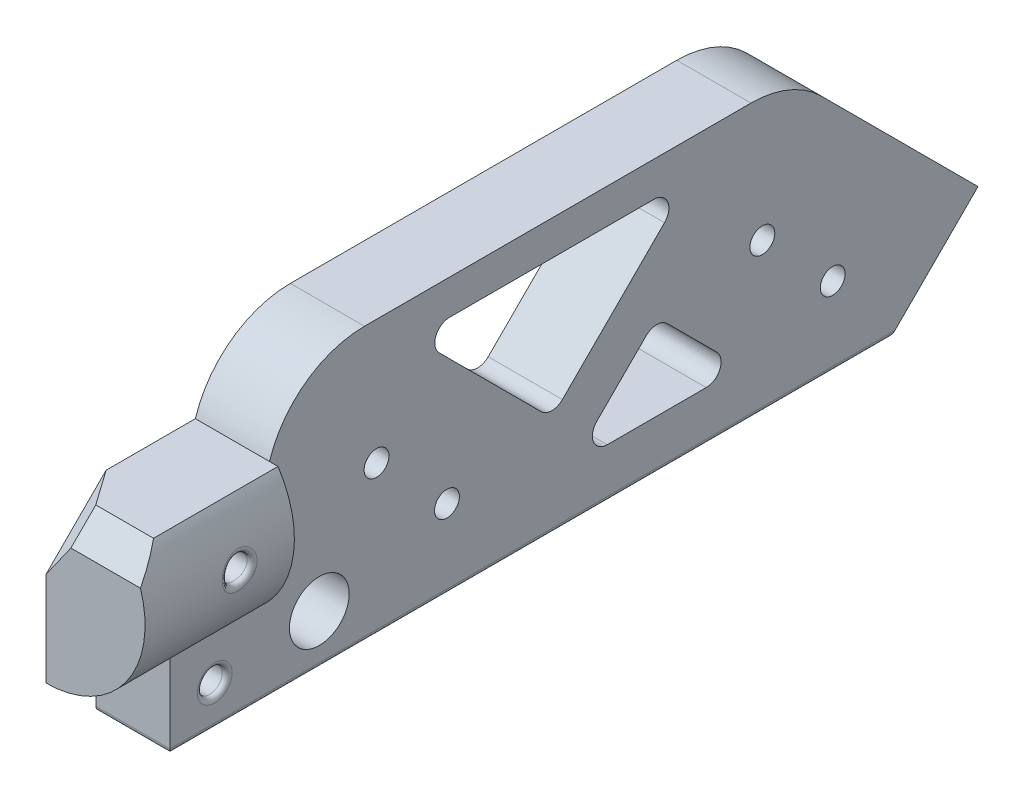
from build123d import *
from build123d.topology import SkipClean

# Parameters (mm, degrees)
EXTRUDE_1_DEPTH            = 21
SKETCH_2_W                 = 20
SKETCH_2_H                 = 20
CUT_EXTRUDE_1_DEPTH        = 10
SKETCH_3_R                 = 25
EXTRUDE_2_DEPTH            = 2
SKETCH_4_W                 = 20
SKETCH_4_H                 = 20
CUT_EXTRUDE_2_DEPTH        = 20
SKETCH_5_W                 = 67.669648092
SKETCH_5_H                 = 52.455829112
CUT_EXTRUDE_3_DEPTH        = 22
EXTRUDE_5_DEPTH            = 1
CUT_EXTRUDE_START          = -6
CUT_EXTRUDE_12_DEPTH       = 6
CUT_EXTRUDE_13_DEPTH       = 2
SKETCH_21_W                = 20
SKETCH_21_H                = 20
EXTRUDE_7_DEPTH            = 19
SKETCH_22_W                = 30
SKETCH_22_H                = 20
EXTRUDE_8_DEPTH            = 10
EXTRUDE_START              = 10
EXTRUDE_9_DEPTH            = 10
SKETCH_24_W                = 30
SKETCH_24_H                = 50
EXTRUDE_10_DEPTH           = 160
SKETCH_26_R                = 2.5
CUT_EXTRUDE_15_DEPTH       = 50
CUT_EXTRUDE_1_2_DEPTH      = 10
CUT_EXTRUDE_1_2_DEPTH_BACK = 10
SKETCH_28_W                = 30
SKETCH_28_H                = 160
EXTRUDE_11_DEPTH           = 5
CUT_EXTRUDE_16_DEPTH       = 25
CUT_EXTRUDE_16_DEPTH_BACK  = 60
SKETCH_29_R                = 2.5
CUT_EXTRUDE_17_DEPTH       = 60
CUT_EXTRUDE_18_DEPTH       = 60
CUT_EXTRUDE_18_DEPTH_BACK  = 60
CUT_EXTRUDE_19_DEPTH       = 60
CUT_EXTRUDE_19_DEPTH_BACK  = 60
FILLET_4_R                 = 3
CUT_EXTRUDE_20_DEPTH       = 60
CUT_EXTRUDE_20_DEPTH_BACK  = 60
SKETCH_33_R                = 6
CUT_EXTRUDE_21_DEPTH       = 60
FILLET_5_R                 = 20
SKETCH_35_R                = 2.5
CUT_EXTRUDE_22_DEPTH       = 60
FILLET_6_R                 = 20
SKETCH_36_W                = 257.466692503
SKETCH_36_H                = 187.225779306
CUT_EXTRUDE_23_DEPTH       = 82
CUT_EXTRUDE_24_DEPTH       = 0.1
FILLET_7_R                 = 1
FILLET_8_R                 = 1
CHAMFER_1_SIZE             = 5
CHAMFER_2_SIZE             = 5


with BuildPart() as part:
    # 草图1 → 凸台-拉伸1 (new body)
    with BuildSketch(Plane.XY):
        with BuildLine():
            Line((16.703293088, 11), (-16.703293088, 11))
            ThreePointArc((-16.703293088, 11), (0, -20), (16.703293088, 11))
        make_face()
    extrude(amount=EXTRUDE_1_DEPTH)

    # 草图2 → Cut-Extrude 1 (cut)
    with BuildSketch(Plane.XY.offset(21)):
        Rectangle(SKETCH_2_W, SKETCH_2_H)
    extrude(amount=-CUT_EXTRUDE_1_DEPTH, mode=Mode.SUBTRACT)

    # 草图3 → 凸台-拉伸2 (add)
    with BuildSketch(Plane(origin=(0, 0, 0), x_dir=(-1, 0, 0), z_dir=(0, 0, -1))):
        Circle(SKETCH_3_R)
        with BuildLine():
            Line((16.703293088, 11), (-16.703293088, 11))
            ThreePointArc((-16.703293088, 11), (0, -20), (16.703293088, 11))
        make_face(mode=Mode.SUBTRACT)
    extrude(amount=-EXTRUDE_2_DEPTH)

    # 草图4 → 切除-拉伸2 (cut)
    with BuildSketch(Plane.XY.offset(11)):
        Rectangle(SKETCH_4_W, SKETCH_4_H)
    extrude(amount=-CUT_EXTRUDE_2_DEPTH, mode=Mode.SUBTRACT)

    # 草图5 → 切除-拉伸3 (cut)
    with BuildSketch(Plane(origin=(0, 11, 0), x_dir=(1, 0, 0), z_dir=(0, 1, 0))):
        Rectangle(SKETCH_5_W, SKETCH_5_H)
    extrude(amount=CUT_EXTRUDE_3_DEPTH, mode=Mode.SUBTRACT)

    # 草图10 → 凸台-拉伸5 (add)
    with BuildSketch(Plane.XY.offset(21)):
        with BuildLine():
            Line((16.703293088, 11), (-16.703293088, 11))
            ThreePointArc((-16.703293088, 11), (0, -20), (16.703293088, 11))
        make_face()
    extrude(amount=EXTRUDE_5_DEPTH)

    # 草图18 → 切除-拉伸12 (cut)
    with SkipClean():  # the faces are left unmerged after this step: merging them gives an invalid solid
        with BuildSketch(Plane.XY.offset(2).offset(CUT_EXTRUDE_START)):
            with BuildLine():
                Line((-16.703293088, 11), (-22.449944321, 11))
                ThreePointArc((-22.449944321, 11), (0, -25), (22.449944321, 11))
                Line((22.449944321, 11), (16.703293088, 11))
                ThreePointArc((16.703293088, 11), (0, -20), (-16.703293088, 11))
            make_face()
        extrude(amount=CUT_EXTRUDE_12_DEPTH, mode=Mode.SUBTRACT)

    # 草图19 → 切除-拉伸13 (cut)
    with BuildSketch(Plane(origin=(0, 0, 0), x_dir=(-1, 0, 0), z_dir=(0, 0, -1))):
        with BuildLine():
            Line((16.703293088, 11), (-16.703293088, 11))
            ThreePointArc((-16.703293088, 11), (0, -20), (16.703293088, 11))
        make_face()
    extrude(amount=-CUT_EXTRUDE_13_DEPTH, mode=Mode.SUBTRACT)

    # 草图21 → 凸台-拉伸7 (add)
    with BuildSketch(Plane(origin=(0, 0, 21), x_dir=(-1, 0, 0), z_dir=(0, 0, -1))):
        Rectangle(SKETCH_21_W, SKETCH_21_H)
    extrude(amount=EXTRUDE_7_DEPTH)

    # 草图22 → 凸台-拉伸8 (add)
    with BuildSketch(Plane(origin=(0, 0, 2), x_dir=(-1, 0, 0), z_dir=(0, 0, -1))):
        with Locations((0, -20)):
            Rectangle(SKETCH_22_W, SKETCH_22_H)
    extrude(amount=-EXTRUDE_8_DEPTH)

    # 草图23 → 凸台-拉伸9 (add)
    with SkipClean():  # the faces are left unmerged after this step: merging them gives an invalid solid
        with BuildSketch(Plane(origin=(0, 0, 2), x_dir=(-1, 0, 0), z_dir=(0, 0, -1)).offset(EXTRUDE_START)):
            with BuildLine():
                Line((-15, -13.228756555), (-15, -30))
                Line((-15, -30), (15, -30))
                Line((15, -30), (15, -13.228756555))
                ThreePointArc((15, -13.228756555), (19.950760868, -1.402547961), (16.703293088, 11))
                Line((16.703293088, 11), (-16.703293088, 11))
                ThreePointArc((-16.703293088, 11), (-19.950760868, -1.402547961), (-15, -13.228756555))
            make_face()
        extrude(amount=-EXTRUDE_9_DEPTH)

    # 草图24 → 凸台-拉伸10 (add)
    with SkipClean():  # the faces are left unmerged after this step: merging them gives an invalid solid
        with BuildSketch(Plane(origin=(0, 0, -8), x_dir=(-1, 0, 0), z_dir=(0, 0, -1))):
            with Locations((0, -5)):
                Rectangle(SKETCH_24_W, SKETCH_24_H)
        extrude(amount=EXTRUDE_10_DEPTH)

    # 草图26 → 切除-拉伸15 (cut)
    with SkipClean():  # the faces are left unmerged after this step: merging them gives an invalid solid
        with BuildSketch(Plane.ZY.offset(15)):
            with Locations((-107, 0)):
                Circle(SKETCH_26_R)
            with Locations((-29.5, 0)):
                Circle(SKETCH_26_R)
        extrude(amount=-CUT_EXTRUDE_15_DEPTH, mode=Mode.SUBTRACT)

    # 草图27 → Cut-Extrude 1 2 (cut, two sides: drawn at the far end of the back side and taken through both)
    with SkipClean():  # the faces are left unmerged after this step: merging them gives an invalid solid
        with BuildSketch(Plane(origin=(0, 0, 0), x_dir=(0, 0, -1), z_dir=(1, 0, 0)).offset(-CUT_EXTRUDE_1_2_DEPTH_BACK)):
            Polygon((89.32233047, 3.535533906), (138.819805153, -45.961940777), (152.961940777, -31.819805153), (103.464466094, 17.67766953), align=None)
            Polygon((11.82233047, 3.535533906), (61.319805153, -45.961940777), (75.461940777, -31.819805153), (25.964466094, 17.67766953), align=None)
        extrude(amount=CUT_EXTRUDE_1_2_DEPTH + CUT_EXTRUDE_1_2_DEPTH_BACK, mode=Mode.SUBTRACT)

    # 草图28 → 凸台-拉伸11 (add)
    with SkipClean():  # the faces are left unmerged after this step: merging them gives an invalid solid
        with BuildSketch(Plane(origin=(0, 20, 0), x_dir=(1, 0, 0), z_dir=(0, 1, 0))):
            with Locations((0, 88)):
                Rectangle(SKETCH_28_W, SKETCH_28_H)
        extrude(amount=EXTRUDE_11_DEPTH)

    # 草图29 → 切除-拉伸16 (cut, two sides: drawn at the far end of the back side and taken through both)
    with SkipClean():  # the faces are left unmerged after this step: merging them gives an invalid solid
        with BuildSketch(Plane.ZY.offset(15).offset(-CUT_EXTRUDE_16_DEPTH_BACK)):
            with Locations(Location((3, 0, 0), (0, 0, 180))):
                Circle(SKETCH_29_R)
            with Locations(Location((3, -22, 0), (0, 0, 90))):
                Circle(SKETCH_29_R)
        extrude(amount=CUT_EXTRUDE_16_DEPTH + CUT_EXTRUDE_16_DEPTH_BACK, mode=Mode.SUBTRACT)

    # 草图30 → 切除-拉伸17 (cut)
    with SkipClean():  # the faces are left unmerged after this step: merging them gives an invalid solid
        with BuildSketch(Plane.ZY.offset(15)):
            Polygon((-113, 25), (-168, -30), (-168, 25), align=None)
        extrude(amount=-CUT_EXTRUDE_17_DEPTH, mode=Mode.SUBTRACT)

    # 草图31 → 切除-拉伸18 (cut, two sides: drawn at the far end of the back side and taken through both)
    with SkipClean():  # the faces are left unmerged after this step: merging them gives an invalid solid
        with BuildSketch(Plane(origin=(0, 0, 0), x_dir=(0, 0, -1), z_dir=(1, 0, 0)).offset(-CUT_EXTRUDE_18_DEPTH_BACK)):
            Polygon((92.473088065, 18), (64.714466094, -9.758621971), (36.955844123, 18), align=None)
        extrude(amount=CUT_EXTRUDE_18_DEPTH + CUT_EXTRUDE_18_DEPTH_BACK, mode=Mode.SUBTRACT)

    # 草图32 → 切除-拉伸19 (cut, two sides: drawn at the far end of the back side and taken through both)
    with SkipClean():  # the faces are left unmerged after this step: merging them gives an invalid solid
        with BuildSketch(Plane(origin=(0, 0, 0), x_dir=(0, 0, -1), z_dir=(1, 0, 0)).offset(-CUT_EXTRUDE_19_DEPTH_BACK)):
            Polygon((85.786796564, -2.828427125), (102.95836944, -20), (68.615223689, -20), align=None)
        extrude(amount=CUT_EXTRUDE_19_DEPTH + CUT_EXTRUDE_19_DEPTH_BACK, mode=Mode.SUBTRACT)

    # 圆角4
    fillet_4_edges = [part.edges().sort_by_distance(p)[0] for p in [
        (0, 18, -92.473088065),
        (0, 18, -36.955844123),
        (0, -9.758621971, -64.714466094),
        (0, -2.828427125, -85.786796564),
        (0, -20, -68.615223689),
        (0, -20, -102.95836944),
    ]]
    fillet(fillet_4_edges, radius=FILLET_4_R)

    # 草图33 → 切除-拉伸20 (cut, two sides: drawn at the far end of the back side and taken through both)
    with BuildSketch(Plane(origin=(0, 0, 0), x_dir=(0, 0, -1), z_dir=(1, 0, 0)).offset(-CUT_EXTRUDE_20_DEPTH_BACK)):
        with Locations(Location((18, -20, 0), (0, 0, 180))):
            Circle(SKETCH_33_R)
    extrude(amount=CUT_EXTRUDE_20_DEPTH + CUT_EXTRUDE_20_DEPTH_BACK, mode=Mode.SUBTRACT)

    # 草图34 → 切除-拉伸21 (cut)
    with BuildSketch(Plane.ZY.offset(15)):
        Polygon((-150.32233047, -12.32233047), (-132.644660941, -30), (-168, -30), align=None)
    extrude(amount=-CUT_EXTRUDE_21_DEPTH, mode=Mode.SUBTRACT)

    # 圆角5
    fillet_5_edges = [part.edges().sort_by_distance(p)[0] for p in [
        (0, 25, -113),
    ]]
    fillet(fillet_5_edges, radius=FILLET_5_R)

    # 草图35 → 切除-拉伸22 (cut)
    with BuildSketch(Plane.ZY.offset(15)):
        with Locations((-29.5, 0)):
            Circle(SKETCH_35_R)
        with Locations((-107, 0)):
            Circle(SKETCH_35_R)
        with Locations((-121.142135624, -14.142135624)):
            Circle(SKETCH_35_R)
        with Locations((-43.642135624, -14.142135624)):
            Circle(SKETCH_35_R)
    extrude(amount=-CUT_EXTRUDE_22_DEPTH, mode=Mode.SUBTRACT)

    # 圆角6
    # the kernel refuses this fillet: 20 mm, written as the material it takes off along each edge
    with BuildSketch(Plane(origin=(-62.696960071, 25, -8), x_dir=(0, 0, -1), z_dir=(1, 0, 0))) as fillet_6_piece_1:
        with BuildLine():
            CenterArc((19.078784028, -20), FILLET_6_R, 90, 72.542396876)
            Line((0, -14), (-0.381575681, -13.88))
            ThreePointArc((-0.381575681, -13.88), (-0.4, -7), (-0.4, 0))
            Line((-0.4, 0), (0, 0.4))
            Line((0, 0.4), (19.078784028, 0.4))
            Line((19.078784028, 0.4), (19.078784028, 0))
        make_face()
    extrude(amount=125.393920142, mode=Mode.SUBTRACT)

    # 草图36 → 切除-拉伸23 (cut)
    with BuildSketch(Plane(origin=(0, 0, 0), x_dir=(0, 0, -1), z_dir=(1, 0, 0))):
        with Locations((64.036181404, -32.621103346)):
            Rectangle(SKETCH_36_W, SKETCH_36_H)
    extrude(amount=-CUT_EXTRUDE_23_DEPTH, mode=Mode.SUBTRACT)

    # 草图37 → 切除-拉伸24 (cut)
    with BuildSketch(Plane.ZY):
        with BuildLine():
            Line((-11.82233047, 3.535533906), (-45.357864376, -30))
            Line((-45.357864376, -30), (12, -30))
            Line((12, -30), (12, -20))
            Line((12, -20), (22, -20))
            Line((22, -20), (22, 11))
            Line((22, 11), (-8, 11))
            ThreePointArc((-8, 11), (-15.246624462, 21.124515497), (-27.078784028, 25))
            Line((-27.078784028, 25), (-104.715728753, 25))
            ThreePointArc((-104.715728753, 25), (-112.3693974, 23.47759065), (-118.857864376, 19.142135624))
            Line((-118.857864376, 19.142135624), (-150.32233047, -12.32233047))
            Line((-150.32233047, -12.32233047), (-141.893398282, -20.751262658))
            Line((-141.893398282, -20.751262658), (-103.464466094, 17.67766953))
            Line((-103.464466094, 17.67766953), (-89.32233047, 3.535533906))
            Line((-89.32233047, 3.535533906), (-122.857864376, -30))
            Line((-122.857864376, -30), (-73.642135624, -30))
            Line((-73.642135624, -30), (-25.964466094, 17.67766953))
            Line((-25.964466094, 17.67766953), (-11.82233047, 3.535533906))
        make_face()
    extrude(amount=-CUT_EXTRUDE_24_DEPTH, mode=Mode.SUBTRACT)

    # 圆角7
    fillet_7_edges = [part.edges().sort_by_distance(p)[0] for p in [
        (20, 0, 5.5),
        (15, -24.5, 3),
    ]]
    fillet(fillet_7_edges, radius=FILLET_7_R)

    # 圆角8
    fillet_8_edges = [part.edges().sort_by_distance(p)[0] for p in [
        (15, -30, -60.32233047),
        (7.55, -30, 12),
    ]]
    fillet(fillet_8_edges, radius=FILLET_8_R)

    # 倒角1
    chamfer_1_edges = [part.edges().sort_by_distance(p)[0] for p in [
        (8.401646544, 11, 22),
    ]]
    chamfer(chamfer_1_edges, length=CHAMFER_1_SIZE)

    # 倒角2
    chamfer_2_edges = [part.edges().sort_by_distance(p)[0] for p in [
        (0.1, 8.5, 19.5),
    ]]
    chamfer(chamfer_2_edges, length=CHAMFER_2_SIZE)


solid = part.part
